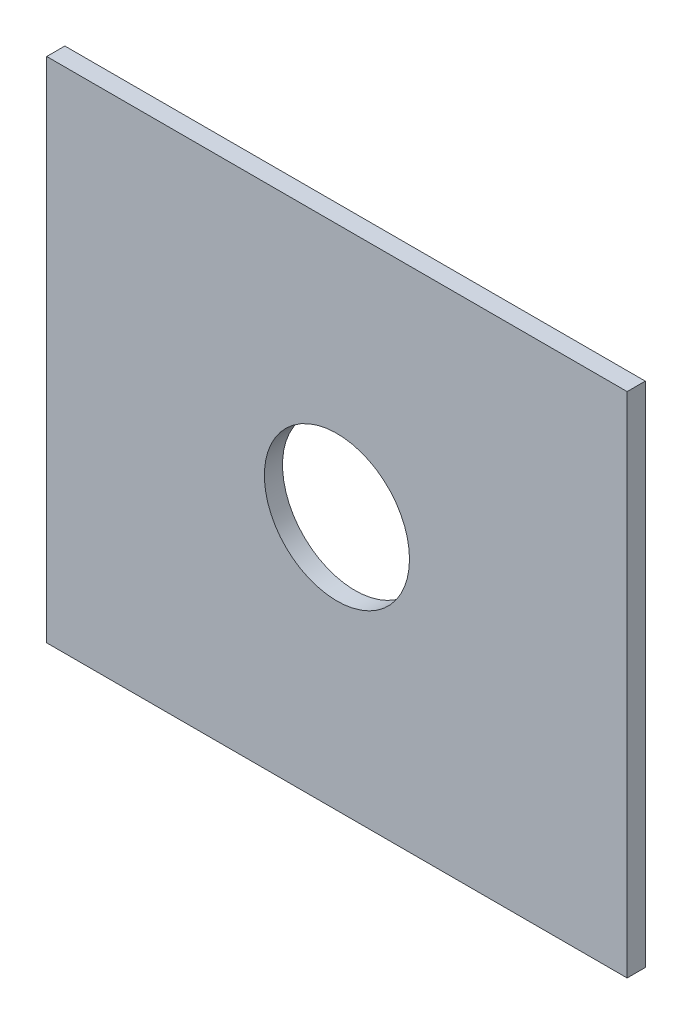
from build123d import *

# Parameters (mm, degrees)
SKETCH1_W          = 50.8
SKETCH1_H          = 44.45
EXTRUDE1_DEPTH     = 1.5875
SKETCH2_R          = 6.35
CUT_EXTRUDE1_DEPTH = 62.113595562


with BuildPart() as part:
    # Sketch1 → Extrude1 (new body)
    with BuildSketch(Plane.XY):
        with Locations((0, 33.3375)):
            Rectangle(SKETCH1_W, SKETCH1_H)
    extrude(amount=EXTRUDE1_DEPTH)

    # Sketch2 → Cut-Extrude1 (cut, through all)
    with BuildSketch(Plane.XY.offset(1.5875)):
        with Locations((0, 33.3375)):
            Circle(SKETCH2_R)
    extrude(amount=-CUT_EXTRUDE1_DEPTH, mode=Mode.SUBTRACT)


solid = part.part
